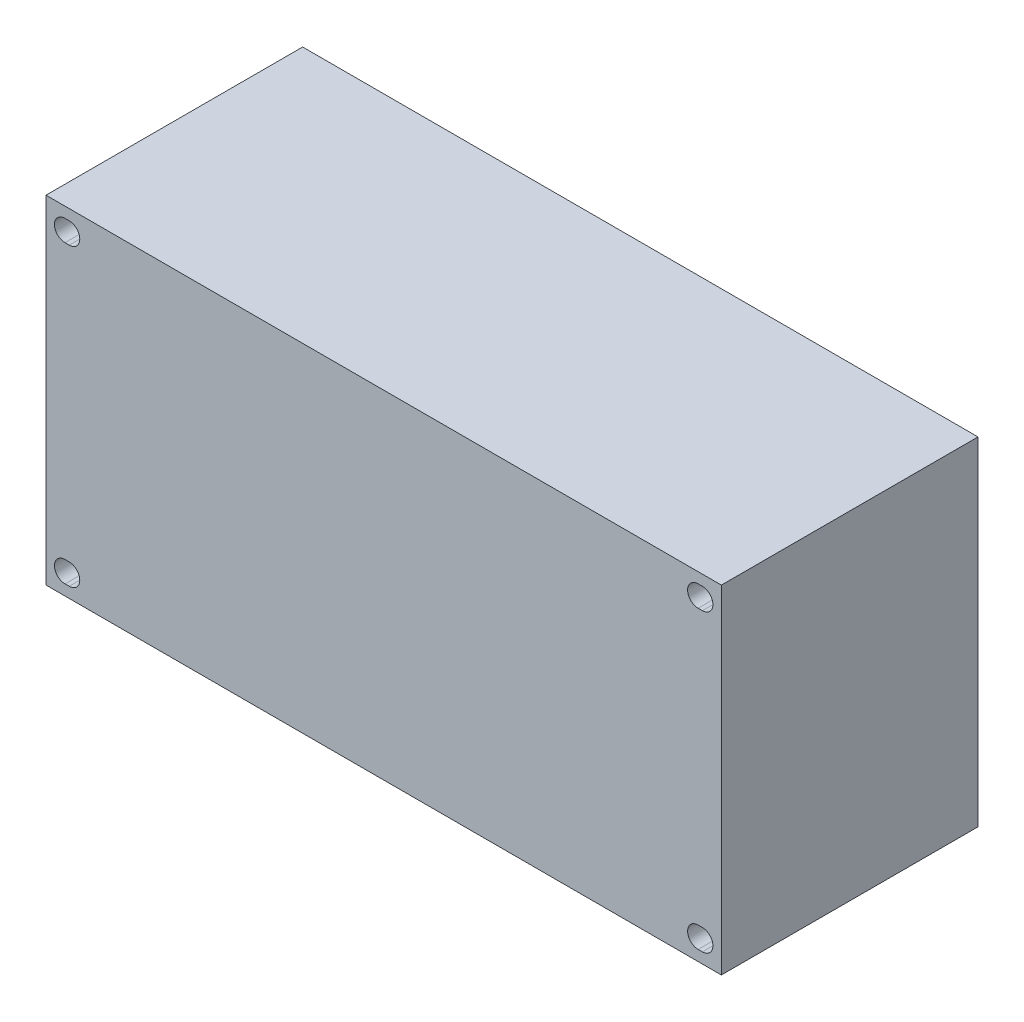
from build123d import *

# Parameters (mm, degrees)
SKETCH1_W            = 101.6
SKETCH1_H            = 50.8
BOSS_EXTRUDE1_DEPTH  = 38.608
CUT_EXTRUDE1_DEPTH   = 69.67588852
MIRROR2_COPY_1_DEPTH = 69.67588852
MIRROR2_COPY_2_DEPTH = 69.67588852


with BuildPart() as part:
    # Sketch1 → Boss-Extrude1 (new body)
    with BuildSketch(Plane.XY):
        Rectangle(SKETCH1_W, SKETCH1_H)
    extrude(amount=BOSS_EXTRUDE1_DEPTH)

    # Sketch4 → Cut-Extrude1 (cut, through all)
    with BuildSketch(Plane.XY.offset(38.608)):
        with BuildLine():
            Line((47.3075, 23.8125), (47.9425, 23.8125))
            ThreePointArc((47.9425, 23.8125), (49.53, 22.225), (47.9425, 20.6375))
            Line((47.9425, 20.6375), (47.3075, 20.6375))
            ThreePointArc((47.3075, 20.6375), (45.72, 22.225), (47.3075, 23.8125))
        make_face()
    cut_extrude1 = extrude(amount=-CUT_EXTRUDE1_DEPTH, mode=Mode.SUBTRACT)

    # Mirror1: Cut-Extrude1 across plane
    add(cut_extrude1.mirror(Plane.ZX), mode=Mode.SUBTRACT)

    # Mirror2 copy 1 sketch → Mirror2 copy 1 (cut, through all)
    with BuildSketch(Plane(origin=(0, 0, 38.608), x_dir=(-1, 0, 0), z_dir=(0, 0, 1))):
        with BuildLine():
            Line((47.3075, 23.8125), (47.9425, 23.8125))
            ThreePointArc((47.9425, 23.8125), (49.53, 22.225), (47.9425, 20.6375))
            Line((47.9425, 20.6375), (47.3075, 20.6375))
            ThreePointArc((47.3075, 20.6375), (45.72, 22.225), (47.3075, 23.8125))
        make_face()
    extrude(amount=-MIRROR2_COPY_1_DEPTH, mode=Mode.SUBTRACT)

    # Mirror2 copy 2 sketch → Mirror2 copy 2 (cut, through all)
    with BuildSketch(Plane(origin=(0, 0, 38.608), x_dir=(-1, 0, 0), z_dir=(0, 0, 1))):
        with BuildLine():
            Line((47.3075, -23.8125), (47.9425, -23.8125))
            ThreePointArc((47.9425, -23.8125), (49.53, -22.225), (47.9425, -20.6375))
            Line((47.9425, -20.6375), (47.3075, -20.6375))
            ThreePointArc((47.3075, -20.6375), (45.72, -22.225), (47.3075, -23.8125))
        make_face()
    extrude(amount=-MIRROR2_COPY_2_DEPTH, mode=Mode.SUBTRACT)


solid = part.part
